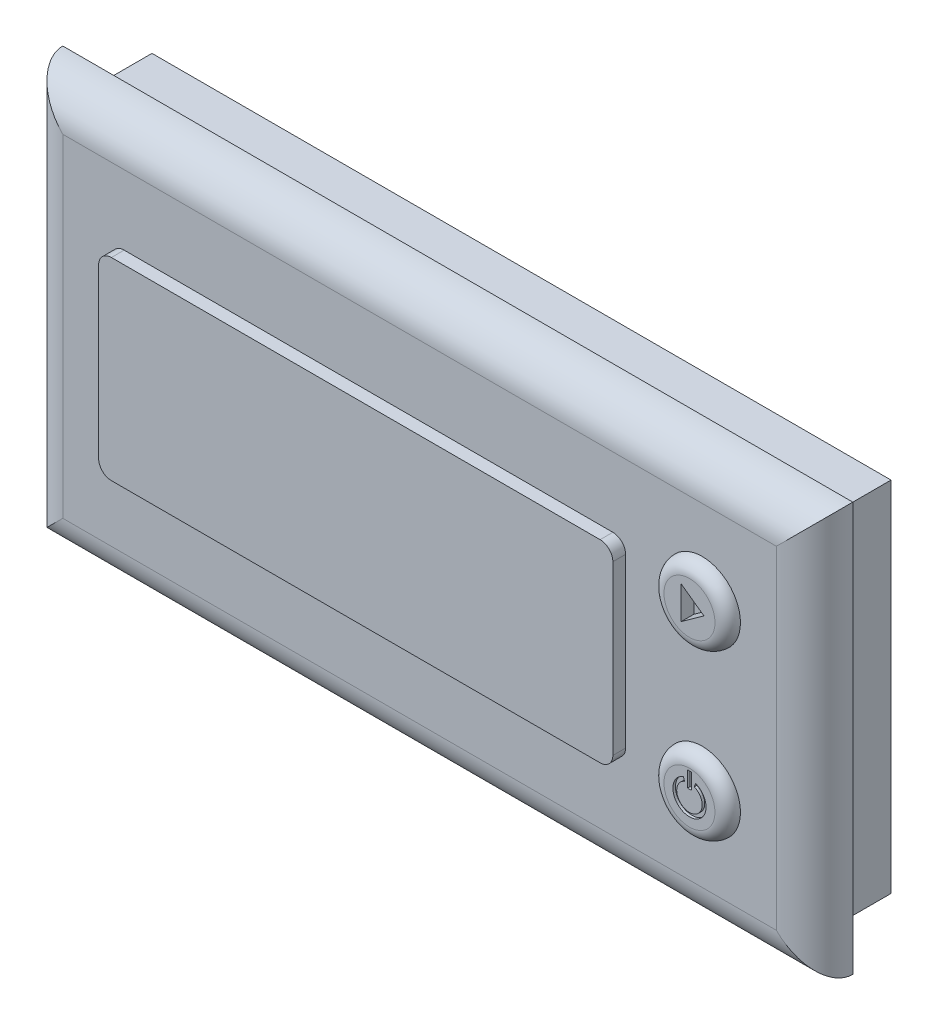
from build123d import *

# Parameters (mm, degrees)
SKETCH1_W           = 58
SKETCH1_H           = 28.1
BOSS_EXTRUDE1_DEPTH = 5
SKETCH2_W           = 62
SKETCH2_H           = 32.1
BOSS_EXTRUDE2_DEPTH = 3
FILLET1_R           = 3
SKETCH3_W           = 40.354739258
SKETCH3_H           = 15.166433462
BOSS_EXTRUDE3_DEPTH = 1
SKETCH3_6_R         = 3.000616935
BOSS_EXTRUDE4_DEPTH = 1
FILLET2_R           = 1
CUT_EXTRUDE2_DEPTH  = 1
CUT_EXTRUDE3_DEPTH  = 0.2
FILLET3_R           = 1


with BuildPart() as part:
    # Sketch1 → Boss-Extrude1 (new body)
    with BuildSketch(Plane.XY):
        Rectangle(SKETCH1_W, SKETCH1_H)
    extrude(amount=BOSS_EXTRUDE1_DEPTH)

    # Sketch2 → Boss-Extrude2 (add)
    with BuildSketch(Plane.XY.offset(5)):
        Rectangle(SKETCH2_W, SKETCH2_H)
    extrude(amount=BOSS_EXTRUDE2_DEPTH)

    # Fillet1
    fillet1_edges = [part.edges().sort_by_distance(p)[0] for p in [
        (0, -16.05, 8),
        (-31, 0, 8),
        (0, 16.05, 8),
        (31, 0, 8),
    ]]
    fillet(fillet1_edges, radius=FILLET1_R - 0.0001)  # a hair under: the kernel refuses the full size

    # Sketch3 → Boss-Extrude3 (add)
    with BuildSketch(Plane.XY.offset(8)):
        with Locations((-4.008748933, 0)):
            Rectangle(SKETCH3_W, SKETCH3_H)
    extrude(amount=BOSS_EXTRUDE3_DEPTH)

    # Sketch3<6> → Boss-Extrude4 (add)
    with BuildSketch(Plane.XY.offset(8)):
        with Locations((22.181744095, 6.447404534)):
            Circle(SKETCH3_6_R)
        with Locations(Location((22.181744095, -6.447404534, 0), (0, 0, 180))):
            Circle(SKETCH3_6_R)
    extrude(amount=BOSS_EXTRUDE4_DEPTH)

    # Fillet2
    fillet2_edges = [part.edges().sort_by_distance(p)[0] for p in [
        (19.18112716, 6.447404534, 9),
        (25.182361031, -6.447404534, 9),
    ]]
    fillet(fillet2_edges, radius=FILLET2_R - 0.0001)  # a hair under: the kernel refuses the full size

    # Sketch4 → Cut-Extrude2 (cut)
    with BuildSketch(Plane.XY.offset(9)):
        Polygon((21.526754794, 7.76375697), (21.526754794, 5.190828819), (23.312816568, 6.477292894), align=None)
    extrude(amount=-CUT_EXTRUDE2_DEPTH, mode=Mode.SUBTRACT)

    # Sketch5 → Cut-Extrude3 (cut)
    with BuildSketch(Plane.XY.offset(9)):
        with BuildLine():
            Line((22.662681188, -5.238974178), (22.559669099, -5.520902001))
            ThreePointArc((22.559669099, -5.520902001), (22.181744095, -7.448021469), (21.803819092, -5.520902001))
            Line((21.803819092, -5.520902001), (21.700807003, -5.238974178))
            ThreePointArc((21.700807003, -5.238974178), (22.181744095, -7.748021469), (22.662681188, -5.238974178))
        make_face()
        with BuildLine():
            Line((22.331744095, -5.86984139), (22.331744095, -4.631238623))
            ThreePointArc((22.331744095, -4.631238623), (22.181744095, -4.625054783), (22.031744095, -4.631238623))
            Line((22.031744095, -4.631238623), (22.031744095, -5.86984139))
            Line((22.031744095, -5.86984139), (22.331744095, -5.86984139))
        make_face()
    extrude(amount=-CUT_EXTRUDE3_DEPTH, mode=Mode.SUBTRACT)

    # Fillet3
    fillet3_edges = [part.edges().sort_by_distance(p)[0] for p in [
        (-24.186118562, 7.583216731, 8.5),
        (-24.186118562, -7.583216731, 8.5),
        (16.168620696, -7.583216731, 8.5),
        (16.168620696, 7.583216731, 8.5),
    ]]
    fillet(fillet3_edges, radius=FILLET3_R)


solid = part.part
